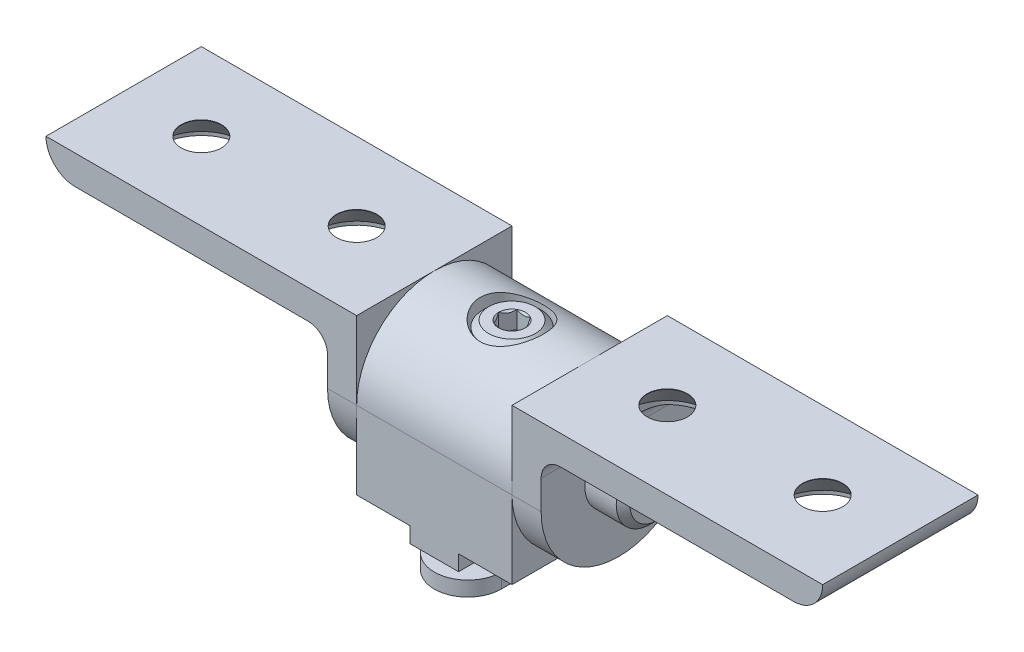
from build123d import *

# Parameters (mm, degrees)
SKETCH2_R           = 3.175
BOSS_EXTRUDE1_DEPTH = 12.7
SKETCH3_W           = 7.9248
SKETCH3_H           = 2.54
BOSS_EXTRUDE2_DEPTH = 3.9624
BOSS_EXTRUDE8_DEPTH = 12.7
SKETCH23_R          = 4.7625
CUT_EXTRUDE7_DEPTH  = 55.091601994
LPATTERN1_COUNT     = 2
LPATTERN1_PITCH     = 25.4
CUT_EXTRUDE1_DEPTH  = 2.8575
SKETCH12_R          = 5.191125
CUT_EXTRUDE3_DEPTH  = 69.063588118
SKETCH13_R          = 3.29819
CUT_EXTRUDE4_DEPTH  = 69.063588118
SKETCH14_R          = 3.175
BOSS_EXTRUDE6_DEPTH = 2.413
SKETCH16_R          = 3.175
BOSS_EXTRUDE7_DEPTH = 25.4
CUT_EXTRUDE5_DEPTH  = 2.8575
CUT_SWEEP1_PITCH    = 1.27
CUT_SWEEP1_FROM     = 0


with BuildPart() as part:
    # Sketch2 → Boss-Extrude1 (new, symmetric)
    with BuildSketch(Plane(origin=(0, 0, 0), x_dir=(0, 0, -1), z_dir=(1, 0, 0))):
        with BuildLine():
            ThreePointArc((-12.7, 12.7), (0, 25.4), (12.7, 12.7))
            Line((12.7, 12.7), (12.7, 0))
            Line((12.7, 0), (-12.7, 0))
            Line((-12.7, 0), (-12.7, 12.7))
        make_face()
        with Locations((0, 12.7)):
            Circle(SKETCH2_R, mode=Mode.SUBTRACT)
    extrude(amount=BOSS_EXTRUDE1_DEPTH, both=True)

    # Sketch3 → Boss-Extrude2 (add, symmetric)
    with BuildSketch(Plane(origin=(0, 0, 0), x_dir=(0, 0, -1), z_dir=(1, 0, 0))):
        with Locations((8.7376, -1.27)):
            Rectangle(SKETCH3_W, SKETCH3_H)
        with Locations((-8.7376, -1.27)):
            Rectangle(SKETCH3_W, SKETCH3_H)
    extrude(amount=BOSS_EXTRUDE2_DEPTH, both=True)

    # Sketch12 → Cut-Extrude3 (cut, through all)
    with BuildSketch(Plane(origin=(0, 18.415, 0), x_dir=(1, 0, 0), z_dir=(0, 1, 0))):
        with Locations(Location((0, 0, 0), (0, 0, 180))):
            Circle(SKETCH12_R)
    extrude(amount=CUT_EXTRUDE3_DEPTH, mode=Mode.SUBTRACT)

    # Sketch13 → Cut-Extrude4 (cut, through all)
    with BuildSketch(Plane(origin=(0, 18.415, 0), x_dir=(1, 0, 0), z_dir=(0, 1, 0))):
        with Locations(Location((0, 0, 0), (0, 0, 270))):
            Circle(SKETCH13_R)
    extrude(amount=-CUT_EXTRUDE4_DEPTH, mode=Mode.SUBTRACT)


with BuildPart() as body_2:
    # Sketch22 → Boss-Extrude8 (new, symmetric)
    with BuildSketch(Plane.XY):
        with BuildLine():
            Line((-12.7, 0), (-12.7, 25.4))
            Line((-12.7, 25.4), (-63.5, 25.4))
            ThreePointArc((-63.5, 25.4), (-62.105096045, 22.032403955), (-58.7375, 20.6375))
            Line((-58.7375, 20.6375), (-20.6375, 20.6375))
            ThreePointArc((-20.6375, 20.6375), (-18.39243597, 19.70756403), (-17.4625, 17.4625))
            Line((-17.4625, 17.4625), (-17.4625, 0))
            Line((-17.4625, 0), (-12.7, 0))
        make_face()
    extrude(amount=BOSS_EXTRUDE8_DEPTH, both=True)

    # Sketch23 → Cut-Extrude7 (cut, through all)
    with BuildSketch(Plane.ZY.offset(17.4625)):
        with Locations((0, 12.7)):
            Circle(SKETCH23_R)
        with BuildLine():
            Line((-12.7, 12.7), (-12.7, -6.985))
            Line((-12.7, -6.985), (12.7, -6.985))
            Line((12.7, -6.985), (12.7, 12.7))
            ThreePointArc((12.7, 12.7), (0, 0), (-12.7, 12.7))
        make_face()
    extrude(amount=-CUT_EXTRUDE7_DEPTH, mode=Mode.SUBTRACT)

    # Sketch24 → Cut-Revolve1 (revolve, cut)
    with BuildSketch(Plane.XY, mode=Mode.PRIVATE) as cut_revolve1_sk:
        Polygon((-54.09819, 25.4), (-54.09819, 25.331851349), (-57.68213, 21.209), (-57.68213, 20.6375), (-57.68213, 12.7), (-50.8, 12.7), (-50.8, 20.6375), (-50.8, 25.4), align=None)
    cut_revolve1 = revolve(cut_revolve1_sk.sketch.rotate(Axis((-50.8, 0, 0), (0, 1, 0)), 270), axis=Axis((-50.8, 0, 0), (0, 1, 0)), mode=Mode.SUBTRACT)

    # LPattern1: Cut-Revolve1 ×2
    with Locations(*[(i * LPATTERN1_PITCH, 0, 0) for i in range(1, LPATTERN1_COUNT)]):
        add(cut_revolve1, mode=Mode.SUBTRACT)


with BuildPart() as body_3:
    # Sketch8 → Revolve1 (revolve)
    with BuildSketch(Plane.XY, mode=Mode.PRIVATE) as revolve1_sk:
        Polygon((-22.59965, 18.25625), (-17.4625, 18.25625), (-17.4625, 17.4625), (-12.7, 17.4625), (-12.7, 15.875), (-6.35, 15.875), (-6.35, 12.7), (-23.7109, 12.7), (-23.7109, 17.145), align=None)
    revolve(revolve1_sk.sketch.rotate(Axis((-23.7109, 12.7, 0), (1, 0, 0)), 90), axis=Axis((-23.7109, 12.7, 0), (1, 0, 0)))

    # Sketch9 → Cut-Extrude1 (cut)
    with BuildSketch(Plane.ZY.offset(23.7109)):
        Polygon((0, 14.899704526), (-1.905, 13.799852263), (-1.905, 11.600147737), (0, 10.500295474), (1.905, 11.600147737), (1.905, 13.799852263), align=None)
    extrude(amount=-CUT_EXTRUDE1_DEPTH, mode=Mode.SUBTRACT)

    # Cut-Extrude2 cone 1 section (through the dimple's axis) → Cut-Extrude2 (revolve, cut)
    with BuildSketch(Plane(origin=(-23.7109, 12.7, 0), x_dir=(0, 0, 1), z_dir=(0, 1, 0))):
        Polygon((0, 0), (2.199704526, 0), (0, 2.199704526), align=None)
    revolve(axis=Axis((-23.7109, 12.7, 0), (1, 0, 0)), mode=Mode.SUBTRACT)


with BuildPart() as body_4:
    # Mirror2: mirrored copy
    add(body_3.part.mirror(Plane(origin=(0, 0, 0), x_dir=(0, 0, 1), z_dir=(1, 0, 0))))


with BuildPart() as body_5:
    # Mirror2 2: mirrored copy
    add(body_2.part.mirror(Plane(origin=(0, 0, 0), x_dir=(0, 0, 1), z_dir=(1, 0, 0))))


with BuildPart() as body_6:
    # Sketch14 → Boss-Extrude6 (new body)
    with BuildSketch(Plane(origin=(0, -6.985, 0), x_dir=(1, 0, 0), z_dir=(0, 1, 0))):
        with BuildLine():
            Line((5.476875, 7.223125), (5.476875, -7.223125))
            ThreePointArc((5.476875, -7.223125), (0, -12.7), (-5.476875, -7.223125))
            Line((-5.476875, -7.223125), (-5.476875, 7.223125))
            ThreePointArc((-5.476875, 7.223125), (0, 12.7), (5.476875, 7.223125))
        make_face()
        with Locations(Location((0, 0, 0), (0, 0, 270))):
            Circle(SKETCH14_R, mode=Mode.SUBTRACT)
    extrude(amount=BOSS_EXTRUDE6_DEPTH)


with BuildPart() as body_7:
    # Sketch16 → Boss-Extrude7 (new body)
    with BuildSketch(Plane(origin=(0, 18.415, 0), x_dir=(1, 0, 0), z_dir=(0, 1, 0))):
        with Locations(Location((0, 0, 0), (0, 0, 270))):
            Circle(SKETCH16_R)
    extrude(amount=-BOSS_EXTRUDE7_DEPTH)

    # Sketch19 → Revolve3 (revolve)
    with BuildSketch(Plane(origin=(0, 0, 0), x_dir=(0, 0, -1), z_dir=(1, 0, 0)), mode=Mode.PRIVATE) as revolve3_sk:
        Polygon((0, 18.415), (0, 24.765), (3.81, 24.765), (4.7625, 23.8125), (4.7625, 18.415), align=None)
    revolve(revolve3_sk.sketch.rotate(Axis((0, 25.4, 0), (0, -1, 0)), 180), axis=Axis((0, 25.4, 0), (0, -1, 0)))

    # Sketch20 → Cut-Extrude5 (cut)
    with BuildSketch(Plane(origin=(0, 24.765, 0), x_dir=(1, 0, 0), z_dir=(0, 1, 0))):
        Polygon((1.099852263, 1.905), (-1.099852263, 1.905), (-2.199704526, 0), (-1.099852263, -1.905), (1.099852263, -1.905), (2.199704526, 0), align=None)
    extrude(amount=-CUT_EXTRUDE5_DEPTH, mode=Mode.SUBTRACT)

    # Cut-Extrude6 cone 1 section (through the dimple's axis) → Cut-Extrude6 (revolve, cut)
    with BuildSketch(Plane(origin=(0, 24.765, 0), x_dir=(0, 0, 1), z_dir=(1, 0, 0))):
        Polygon((0, 0), (2.199704526, 0), (0, 2.199704526), align=None)
    revolve(axis=Axis((0, 24.765, 0), (0, -1, 0)), mode=Mode.SUBTRACT)

    # Cut-Sweep1: arcs per turn and ends read off the stored shape
    # Cut-Sweep1: the profile of Sketch18 profile screwed along a right-hand helix through 22 turns, 8 arcs to a turn; built about Z, then put on its axis
    cut_sweep1_z = Axis((0, 0, 0), (0, 0, 1))
    cut_sweep1_corners = [(3.1753, 0, -2.381423205), (3.1753, 0, -1.269826795), (2.350110803, 0, -1.74625), (2.350110803, 0, -1.905)]
    with BuildLine(mode=Mode.PRIVATE) as cut_sweep1_profile:
        Line(cut_sweep1_corners[0], cut_sweep1_corners[1])
        Line(cut_sweep1_corners[1], cut_sweep1_corners[2])
        Line(cut_sweep1_corners[2], cut_sweep1_corners[3])
        Line(cut_sweep1_corners[3], cut_sweep1_corners[0])
    cut_sweep1_cap = Face(cut_sweep1_profile.wire())
    cut_sweep1_turn_angles = [0, 22.5, 45, 67.5, 90, 112.5, 135, 157.5, 180, 202.5, 225, 247.5, 270, 292.5, 315, 337.5, 360]
    cut_sweep1_turn_weights = [1, 0.9238795325112867, 1, 0.9238795325112867, 1, 0.9238795325112867, 1, 0.9238795325112867, 1, 0.9238795325112867, 1, 0.9238795325112867, 1, 0.9238795325112867, 1, 0.9238795325112867, 1]
    cut_sweep1_turn_rails = [Edge.make_bspline([Vector(p[0], p[1], 0).rotate(cut_sweep1_z, cut_sweep1_turn_angles[k]) / cut_sweep1_turn_weights[k] + Vector(0, 0, p[2] + CUT_SWEEP1_PITCH * cut_sweep1_turn_angles[k] / 360) for k in range(17)], [0, 0, 0, 1, 1, 2, 2, 3, 3, 4, 4, 5, 5, 6, 6, 7, 7, 8, 8, 8], 2, cut_sweep1_turn_weights) for p in cut_sweep1_corners]
    cut_sweep1_turn_sides = [Face.make_surface_from_curves(cut_sweep1_turn_rails[p[0]], cut_sweep1_turn_rails[p[1]]) for p in [(0, 1), (1, 2), (2, 3), (3, 0)]]
    cut_sweep1 = Plane(origin=(0, 18.415, 0), x_dir=(0, 0, 1), z_dir=(0, -1, 0)) * split(Solid(Shell([*[p.moved(Location((0, 0, CUT_SWEEP1_PITCH * i))) for i in range(22) for p in cut_sweep1_turn_sides], cut_sweep1_cap, cut_sweep1_cap.rotate(cut_sweep1_z, 7920).moved(Location((0, 0, CUT_SWEEP1_PITCH * 7920 / 360)))])), bisect_by=Plane.XY.offset(CUT_SWEEP1_FROM), keep=Keep.TOP, mode=Mode.PRIVATE)
    add(cut_sweep1, mode=Mode.SUBTRACT)


solid = Compound([part.part, body_2.part, body_3.part, body_4.part, body_5.part, body_6.part, body_7.part])
